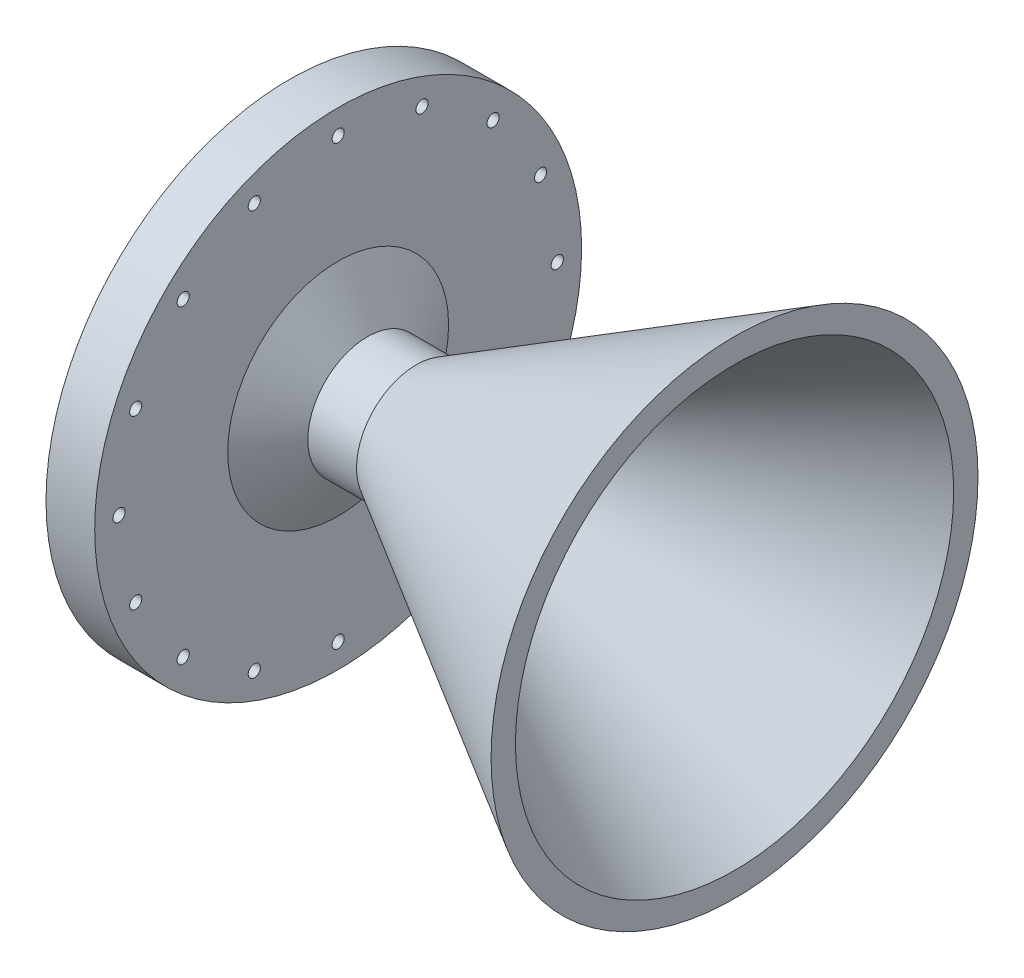
from build123d import *

# Parameters (mm, degrees)
SKETCH2_R          = 50.00625
SKETCH2_R_2        = 47.625
CUT_EXTRUDE1_DEPTH = 1.190625
CUT_EXTRUDE2_REACH = 148.767
SKETCH3_R          = 1.5875


with BuildPart() as part:
    # Sketch1 → Revolve1 (revolve)
    with BuildSketch(Plane.XY):
        Polygon((0, 15.5575), (83.038845842, 63.5), (83.038845842, 57.15), (0, 7.9375), (-12.7, 7.9375), (-33.047266862, 41.275), (-33.047266862, 50.8), (-33.047266862, 63.5), (-20.347266862, 63.5), (-20.347266862, 28.802954744), (-12.7, 15.5575), align=None)
    revolve(axis=Axis((0, 0, 0), (1, 0, 0)))

    # Sketch2 → Cut-Extrude1 (cut)
    with BuildSketch(Plane.ZY.offset(33.047266862)):
        Circle(SKETCH2_R)
        Circle(SKETCH2_R_2, mode=Mode.SUBTRACT)
    extrude(amount=-CUT_EXTRUDE1_DEPTH, mode=Mode.SUBTRACT)

    # Sketch3 → Cut-Extrude2 (cut, up to next)
    with BuildSketch(Plane.ZY.offset(33.047266862), mode=Mode.PRIVATE) as cut_extrude2_sk1:
        with Locations((0, 57.15)):
            Circle(SKETCH3_R)
    cut_extrude2_tool1 = extrude(cut_extrude2_sk1.sketch, amount=-CUT_EXTRUDE2_REACH, mode=Mode.PRIVATE) & part.part
    # Sketch3 → Cut-Extrude2 (cut, up to next)
    with BuildSketch(Plane.ZY.offset(33.047266862), mode=Mode.PRIVATE) as cut_extrude2_sk2:
        with Locations((21.87035816, 52.799715283)):
            Circle(SKETCH3_R)
    cut_extrude2_tool2 = extrude(cut_extrude2_sk2.sketch, amount=-CUT_EXTRUDE2_REACH, mode=Mode.PRIVATE) & part.part
    # Sketch3 → Cut-Extrude2 (cut, up to next)
    with BuildSketch(Plane.ZY.offset(33.047266862), mode=Mode.PRIVATE) as cut_extrude2_sk3:
        with Locations((40.411152545, 40.411152545)):
            Circle(SKETCH3_R)
    cut_extrude2_tool3 = extrude(cut_extrude2_sk3.sketch, amount=-CUT_EXTRUDE2_REACH, mode=Mode.PRIVATE) & part.part
    # Sketch3 → Cut-Extrude2 (cut, up to next)
    with BuildSketch(Plane.ZY.offset(33.047266862), mode=Mode.PRIVATE) as cut_extrude2_sk4:
        with Locations((52.799715283, 21.87035816)):
            Circle(SKETCH3_R)
    cut_extrude2_tool4 = extrude(cut_extrude2_sk4.sketch, amount=-CUT_EXTRUDE2_REACH, mode=Mode.PRIVATE) & part.part
    # Sketch3 → Cut-Extrude2 (cut, up to next)
    with BuildSketch(Plane.ZY.offset(33.047266862), mode=Mode.PRIVATE) as cut_extrude2_sk5:
        with Locations((57.15, 0)):
            Circle(SKETCH3_R)
    cut_extrude2_tool5 = extrude(cut_extrude2_sk5.sketch, amount=-CUT_EXTRUDE2_REACH, mode=Mode.PRIVATE) & part.part
    # Sketch3 → Cut-Extrude2 (cut, up to next)
    with BuildSketch(Plane.ZY.offset(33.047266862), mode=Mode.PRIVATE) as cut_extrude2_sk6:
        with Locations((52.799715283, -21.87035816)):
            Circle(SKETCH3_R)
    cut_extrude2_tool6 = extrude(cut_extrude2_sk6.sketch, amount=-CUT_EXTRUDE2_REACH, mode=Mode.PRIVATE) & part.part
    # Sketch3 → Cut-Extrude2 (cut, up to next)
    with BuildSketch(Plane.ZY.offset(33.047266862), mode=Mode.PRIVATE) as cut_extrude2_sk7:
        with Locations((40.411152545, -40.411152545)):
            Circle(SKETCH3_R)
    cut_extrude2_tool7 = extrude(cut_extrude2_sk7.sketch, amount=-CUT_EXTRUDE2_REACH, mode=Mode.PRIVATE) & part.part
    # Sketch3 → Cut-Extrude2 (cut, up to next)
    with BuildSketch(Plane.ZY.offset(33.047266862), mode=Mode.PRIVATE) as cut_extrude2_sk8:
        with Locations((21.87035816, -52.799715283)):
            Circle(SKETCH3_R)
    cut_extrude2_tool8 = extrude(cut_extrude2_sk8.sketch, amount=-CUT_EXTRUDE2_REACH, mode=Mode.PRIVATE) & part.part
    # Sketch3 → Cut-Extrude2 (cut, up to next)
    with BuildSketch(Plane.ZY.offset(33.047266862), mode=Mode.PRIVATE) as cut_extrude2_sk9:
        with Locations((0, -57.15)):
            Circle(SKETCH3_R)
    cut_extrude2_tool9 = extrude(cut_extrude2_sk9.sketch, amount=-CUT_EXTRUDE2_REACH, mode=Mode.PRIVATE) & part.part
    # Sketch3 → Cut-Extrude2 (cut, up to next)
    with BuildSketch(Plane.ZY.offset(33.047266862), mode=Mode.PRIVATE) as cut_extrude2_sk10:
        with Locations((-21.87035816, -52.799715283)):
            Circle(SKETCH3_R)
    cut_extrude2_tool10 = extrude(cut_extrude2_sk10.sketch, amount=-CUT_EXTRUDE2_REACH, mode=Mode.PRIVATE) & part.part
    # Sketch3 → Cut-Extrude2 (cut, up to next)
    with BuildSketch(Plane.ZY.offset(33.047266862), mode=Mode.PRIVATE) as cut_extrude2_sk11:
        with Locations((-40.411152545, -40.411152545)):
            Circle(SKETCH3_R)
    cut_extrude2_tool11 = extrude(cut_extrude2_sk11.sketch, amount=-CUT_EXTRUDE2_REACH, mode=Mode.PRIVATE) & part.part
    # Sketch3 → Cut-Extrude2 (cut, up to next)
    with BuildSketch(Plane.ZY.offset(33.047266862), mode=Mode.PRIVATE) as cut_extrude2_sk12:
        with Locations((-52.799715283, -21.87035816)):
            Circle(SKETCH3_R)
    cut_extrude2_tool12 = extrude(cut_extrude2_sk12.sketch, amount=-CUT_EXTRUDE2_REACH, mode=Mode.PRIVATE) & part.part
    # Sketch3 → Cut-Extrude2 (cut, up to next)
    with BuildSketch(Plane.ZY.offset(33.047266862), mode=Mode.PRIVATE) as cut_extrude2_sk13:
        with Locations((-57.15, 0)):
            Circle(SKETCH3_R)
    cut_extrude2_tool13 = extrude(cut_extrude2_sk13.sketch, amount=-CUT_EXTRUDE2_REACH, mode=Mode.PRIVATE) & part.part
    # Sketch3 → Cut-Extrude2 (cut, up to next)
    with BuildSketch(Plane.ZY.offset(33.047266862), mode=Mode.PRIVATE) as cut_extrude2_sk14:
        with Locations((-52.799715283, 21.87035816)):
            Circle(SKETCH3_R)
    cut_extrude2_tool14 = extrude(cut_extrude2_sk14.sketch, amount=-CUT_EXTRUDE2_REACH, mode=Mode.PRIVATE) & part.part
    # Sketch3 → Cut-Extrude2 (cut, up to next)
    with BuildSketch(Plane.ZY.offset(33.047266862), mode=Mode.PRIVATE) as cut_extrude2_sk15:
        with Locations((-40.411152545, 40.411152545)):
            Circle(SKETCH3_R)
    cut_extrude2_tool15 = extrude(cut_extrude2_sk15.sketch, amount=-CUT_EXTRUDE2_REACH, mode=Mode.PRIVATE) & part.part
    # Sketch3 → Cut-Extrude2 (cut, up to next)
    with BuildSketch(Plane.ZY.offset(33.047266862), mode=Mode.PRIVATE) as cut_extrude2_sk16:
        with Locations((-21.87035816, 52.799715283)):
            Circle(SKETCH3_R)
    cut_extrude2_tool16 = extrude(cut_extrude2_sk16.sketch, amount=-CUT_EXTRUDE2_REACH, mode=Mode.PRIVATE) & part.part
    add(cut_extrude2_tool1.solids().sort_by_distance((-33.047267, 57.15, 0))[0], mode=Mode.SUBTRACT)
    add(cut_extrude2_tool2.solids().sort_by_distance((-33.047267, 52.799715, 21.870358))[0], mode=Mode.SUBTRACT)
    add(cut_extrude2_tool3.solids().sort_by_distance((-33.047267, 40.411153, 40.411153))[0], mode=Mode.SUBTRACT)
    add(cut_extrude2_tool4.solids().sort_by_distance((-33.047267, 21.870358, 52.799715))[0], mode=Mode.SUBTRACT)
    add(cut_extrude2_tool5.solids().sort_by_distance((-33.047267, 0, 57.15))[0], mode=Mode.SUBTRACT)
    add(cut_extrude2_tool6.solids().sort_by_distance((-33.047267, -21.870358, 52.799715))[0], mode=Mode.SUBTRACT)
    add(cut_extrude2_tool7.solids().sort_by_distance((-33.047267, -40.411153, 40.411153))[0], mode=Mode.SUBTRACT)
    add(cut_extrude2_tool8.solids().sort_by_distance((-33.047267, -52.799715, 21.870358))[0], mode=Mode.SUBTRACT)
    add(cut_extrude2_tool9.solids().sort_by_distance((-33.047267, -57.15, 0))[0], mode=Mode.SUBTRACT)
    add(cut_extrude2_tool10.solids().sort_by_distance((-33.047267, -52.799715, -21.870358))[0], mode=Mode.SUBTRACT)
    add(cut_extrude2_tool11.solids().sort_by_distance((-33.047267, -40.411153, -40.411153))[0], mode=Mode.SUBTRACT)
    add(cut_extrude2_tool12.solids().sort_by_distance((-33.047267, -21.870358, -52.799715))[0], mode=Mode.SUBTRACT)
    add(cut_extrude2_tool13.solids().sort_by_distance((-33.047267, 0, -57.15))[0], mode=Mode.SUBTRACT)
    add(cut_extrude2_tool14.solids().sort_by_distance((-33.047267, 21.870358, -52.799715))[0], mode=Mode.SUBTRACT)
    add(cut_extrude2_tool15.solids().sort_by_distance((-33.047267, 40.411153, -40.411153))[0], mode=Mode.SUBTRACT)
    add(cut_extrude2_tool16.solids().sort_by_distance((-33.047267, 52.799715, -21.870358))[0], mode=Mode.SUBTRACT)


solid = part.part
